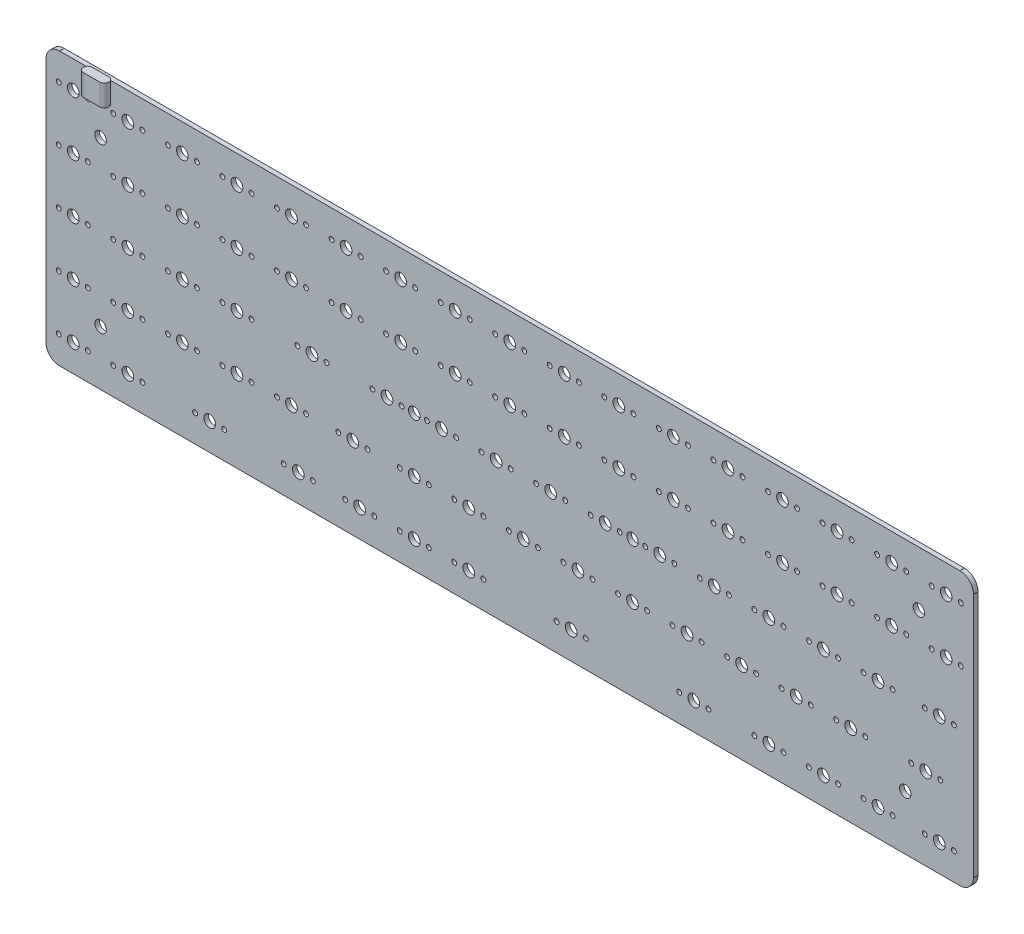
from build123d import *

# Parameters (mm, degrees)
SKETCH2_R                = 0.8534
SKETCH2_R_2              = 2.0447
SKETCH2_R_3              = 2
SKETCH2_R_4              = 0.325
BOSS_EXTRUDE3_DEPTH      = 0.79375
BOSS_EXTRUDE4_DEPTH      = 0.762
BOSS_EXTRUDE4_DEPTH_BACK = 6.731


with BuildPart() as part:
    # Sketch2 → Boss-Extrude3 (new, symmetric)
    with BuildSketch(Plane.XY):
        with BuildLine():
            ThreePointArc((314.2869, -4.7625), (314.298059232, -4.735559232), (314.325, -4.7244))
            Line((314.325, -4.7244), (314.325, 80.9244))
            ThreePointArc((314.325, 80.9244), (314.298059232, 80.935559232), (314.2869, 80.9625))
            ThreePointArc((314.2869, 80.9625), (314.298005094, 80.989386522), (314.324846721, 81.000599692))
            ThreePointArc((314.324846721, 81.000599692), (312.93006375, 84.33006375), (309.600599692, 85.724846721))
            ThreePointArc((309.600599692, 85.724846721), (309.589386522, 85.698005094), (309.5625, 85.6869))
            ThreePointArc((309.5625, 85.6869), (309.535559232, 85.698059232), (309.5244, 85.725))
            Line((309.5244, 85.725), (-4.7244, 85.725))
            ThreePointArc((-4.7244, 85.725), (-4.735559232, 85.698059232), (-4.7625, 85.6869))
            ThreePointArc((-4.7625, 85.6869), (-4.789386522, 85.698005094), (-4.800599692, 85.724846721))
            ThreePointArc((-4.800599692, 85.724846721), (-8.13006375, 84.33006375), (-9.524846721, 81.000599692))
            ThreePointArc((-9.524846721, 81.000599692), (-9.498005094, 80.989386522), (-9.4869, 80.9625))
            ThreePointArc((-9.4869, 80.9625), (-9.498059232, 80.935559232), (-9.525, 80.9244))
            Line((-9.525, 80.9244), (-9.525, -4.7244))
            ThreePointArc((-9.525, -4.7244), (-9.498059232, -4.735559232), (-9.4869, -4.7625))
            ThreePointArc((-9.4869, -4.7625), (-9.498005094, -4.789386522), (-9.524846721, -4.800599692))
            ThreePointArc((-9.524846721, -4.800599692), (-8.13006375, -8.13006375), (-4.800599692, -9.524846721))
            ThreePointArc((-4.800599692, -9.524846721), (-4.789386522, -9.498005094), (-4.7625, -9.4869))
            ThreePointArc((-4.7625, -9.4869), (-4.735559232, -9.498059232), (-4.7244, -9.525))
            Line((-4.7244, -9.525), (309.5244, -9.525))
            ThreePointArc((309.5244, -9.525), (309.535559232, -9.498059232), (309.5625, -9.4869))
            ThreePointArc((309.5625, -9.4869), (309.589386522, -9.498005094), (309.600599692, -9.524846721))
            ThreePointArc((309.600599692, -9.524846721), (312.93006375, -8.13006375), (314.324846721, -4.800599692))
            ThreePointArc((314.324846721, -4.800599692), (314.298005094, -4.789386522), (314.2869, -4.7625))
        make_face()
        with Locations((-5.08, 0)):
            Circle(SKETCH2_R, mode=Mode.SUBTRACT)
        Circle(SKETCH2_R_2, mode=Mode.SUBTRACT)
        with Locations((5.08, 0)):
            Circle(SKETCH2_R, mode=Mode.SUBTRACT)
        with Locations((13.97, 0)):
            Circle(SKETCH2_R, mode=Mode.SUBTRACT)
        with Locations((19.05, 0)):
            Circle(SKETCH2_R_2, mode=Mode.SUBTRACT)
        with Locations((24.13, 0)):
            Circle(SKETCH2_R, mode=Mode.SUBTRACT)
        with Locations((42.545, 0)):
            Circle(SKETCH2_R, mode=Mode.SUBTRACT)
        with Locations((47.625, 0)):
            Circle(SKETCH2_R_2, mode=Mode.SUBTRACT)
        with Locations((52.705, 0)):
            Circle(SKETCH2_R, mode=Mode.SUBTRACT)
        with Locations((9.525, 9.525)):
            Circle(SKETCH2_R_3, mode=Mode.SUBTRACT)
        with Locations((73.5012, 0)):
            Circle(SKETCH2_R, mode=Mode.SUBTRACT)
        with Locations((78.5812, 0)):
            Circle(SKETCH2_R_2, mode=Mode.SUBTRACT)
        with Locations((83.6613, 0)):
            Circle(SKETCH2_R, mode=Mode.SUBTRACT)
        with Locations((94.9325, 0)):
            Circle(SKETCH2_R, mode=Mode.SUBTRACT)
        with Locations((100.0125, 0)):
            Circle(SKETCH2_R_2, mode=Mode.SUBTRACT)
        with Locations((105.0925, 0)):
            Circle(SKETCH2_R, mode=Mode.SUBTRACT)
        with Locations((113.9825, 0)):
            Circle(SKETCH2_R, mode=Mode.SUBTRACT)
        with Locations((119.0625, 0)):
            Circle(SKETCH2_R_2, mode=Mode.SUBTRACT)
        with Locations((124.1425, 0)):
            Circle(SKETCH2_R, mode=Mode.SUBTRACT)
        with Locations((133.0325, 0)):
            Circle(SKETCH2_R, mode=Mode.SUBTRACT)
        with Locations((138.1125, 0)):
            Circle(SKETCH2_R_2, mode=Mode.SUBTRACT)
        with Locations((143.1925, 0)):
            Circle(SKETCH2_R, mode=Mode.SUBTRACT)
        with Locations((-5.08, 19.05)):
            Circle(SKETCH2_R, mode=Mode.SUBTRACT)
        with Locations((0, 19.05)):
            Circle(SKETCH2_R_2, mode=Mode.SUBTRACT)
        with Locations((5.08, 19.05)):
            Circle(SKETCH2_R, mode=Mode.SUBTRACT)
        with Locations((13.97, 19.05)):
            Circle(SKETCH2_R, mode=Mode.SUBTRACT)
        with Locations((19.05, 19.05)):
            Circle(SKETCH2_R_2, mode=Mode.SUBTRACT)
        with Locations((24.13, 19.05)):
            Circle(SKETCH2_R, mode=Mode.SUBTRACT)
        with Locations((33.02, 19.05)):
            Circle(SKETCH2_R, mode=Mode.SUBTRACT)
        with Locations((38.1, 19.05)):
            Circle(SKETCH2_R_2, mode=Mode.SUBTRACT)
        with Locations((43.18, 19.05)):
            Circle(SKETCH2_R, mode=Mode.SUBTRACT)
        with Locations((52.07, 19.05)):
            Circle(SKETCH2_R, mode=Mode.SUBTRACT)
        with Locations((57.15, 19.05)):
            Circle(SKETCH2_R_2, mode=Mode.SUBTRACT)
        with Locations((62.23, 19.05)):
            Circle(SKETCH2_R, mode=Mode.SUBTRACT)
        with Locations((71.12, 19.05)):
            Circle(SKETCH2_R, mode=Mode.SUBTRACT)
        with Locations((76.2, 19.05)):
            Circle(SKETCH2_R_2, mode=Mode.SUBTRACT)
        with Locations((81.28, 19.05)):
            Circle(SKETCH2_R, mode=Mode.SUBTRACT)
        with Locations((92.5513, 19.05)):
            Circle(SKETCH2_R, mode=Mode.SUBTRACT)
        with Locations((97.6313, 19.05)):
            Circle(SKETCH2_R_2, mode=Mode.SUBTRACT)
        with Locations((102.7113, 19.05)):
            Circle(SKETCH2_R, mode=Mode.SUBTRACT)
        with Locations((113.9825, 19.05)):
            Circle(SKETCH2_R, mode=Mode.SUBTRACT)
        with Locations((119.0625, 19.05)):
            Circle(SKETCH2_R_2, mode=Mode.SUBTRACT)
        with Locations((124.1425, 19.05)):
            Circle(SKETCH2_R, mode=Mode.SUBTRACT)
        with Locations((133.0325, 19.05)):
            Circle(SKETCH2_R, mode=Mode.SUBTRACT)
        with Locations((138.1125, 19.05)):
            Circle(SKETCH2_R_2, mode=Mode.SUBTRACT)
        with Locations((143.1925, 19.05)):
            Circle(SKETCH2_R, mode=Mode.SUBTRACT)
        with Locations((152.0825, 19.05)):
            Circle(SKETCH2_R, mode=Mode.SUBTRACT)
        with Locations((168.7512, 0)):
            Circle(SKETCH2_R, mode=Mode.SUBTRACT)
        with Locations((173.8313, 0)):
            Circle(SKETCH2_R_2, mode=Mode.SUBTRACT)
        with Locations((178.9112, 0)):
            Circle(SKETCH2_R, mode=Mode.SUBTRACT)
        with Locations((211.6138, 0)):
            Circle(SKETCH2_R, mode=Mode.SUBTRACT)
        with Locations((216.6938, 0)):
            Circle(SKETCH2_R_2, mode=Mode.SUBTRACT)
        with Locations((221.7738, 0)):
            Circle(SKETCH2_R, mode=Mode.SUBTRACT)
        with Locations((237.8075, 0)):
            Circle(SKETCH2_R, mode=Mode.SUBTRACT)
        with Locations((242.8875, 0)):
            Circle(SKETCH2_R_2, mode=Mode.SUBTRACT)
        with Locations((247.9675, 0)):
            Circle(SKETCH2_R, mode=Mode.SUBTRACT)
        with Locations((256.8575, 0)):
            Circle(SKETCH2_R, mode=Mode.SUBTRACT)
        with Locations((261.9375, 0)):
            Circle(SKETCH2_R_2, mode=Mode.SUBTRACT)
        with Locations((267.0175, 0)):
            Circle(SKETCH2_R, mode=Mode.SUBTRACT)
        with Locations((275.9075, 0)):
            Circle(SKETCH2_R, mode=Mode.SUBTRACT)
        with Locations((280.9875, 0)):
            Circle(SKETCH2_R_2, mode=Mode.SUBTRACT)
        with Locations((286.0675, 0)):
            Circle(SKETCH2_R, mode=Mode.SUBTRACT)
        with Locations((297.3388, 0)):
            Circle(SKETCH2_R, mode=Mode.SUBTRACT)
        with Locations((302.4187, 0)):
            Circle(SKETCH2_R_2, mode=Mode.SUBTRACT)
        with Locations((307.4988, 0)):
            Circle(SKETCH2_R, mode=Mode.SUBTRACT)
        with Locations((290.5125, 9.525)):
            Circle(SKETCH2_R_3, mode=Mode.SUBTRACT)
        with Locations((157.1625, 19.05)):
            Circle(SKETCH2_R_2, mode=Mode.SUBTRACT)
        with Locations((162.2425, 19.05)):
            Circle(SKETCH2_R, mode=Mode.SUBTRACT)
        with Locations((171.1325, 19.05)):
            Circle(SKETCH2_R, mode=Mode.SUBTRACT)
        with Locations((176.2125, 19.05)):
            Circle(SKETCH2_R_2, mode=Mode.SUBTRACT)
        with Locations((181.2925, 19.05)):
            Circle(SKETCH2_R, mode=Mode.SUBTRACT)
        with Locations((190.1825, 19.05)):
            Circle(SKETCH2_R, mode=Mode.SUBTRACT)
        with Locations((195.2625, 19.05)):
            Circle(SKETCH2_R_2, mode=Mode.SUBTRACT)
        with Locations((200.3425, 19.05)):
            Circle(SKETCH2_R, mode=Mode.SUBTRACT)
        with Locations((209.2325, 19.05)):
            Circle(SKETCH2_R, mode=Mode.SUBTRACT)
        with Locations((214.3125, 19.05)):
            Circle(SKETCH2_R_2, mode=Mode.SUBTRACT)
        with Locations((219.3925, 19.05)):
            Circle(SKETCH2_R, mode=Mode.SUBTRACT)
        with Locations((228.2825, 19.05)):
            Circle(SKETCH2_R, mode=Mode.SUBTRACT)
        with Locations((233.3625, 19.05)):
            Circle(SKETCH2_R_2, mode=Mode.SUBTRACT)
        with Locations((238.4425, 19.05)):
            Circle(SKETCH2_R, mode=Mode.SUBTRACT)
        with Locations((247.3325, 19.05)):
            Circle(SKETCH2_R, mode=Mode.SUBTRACT)
        with Locations((252.4125, 19.05)):
            Circle(SKETCH2_R_2, mode=Mode.SUBTRACT)
        with Locations((257.4925, 19.05)):
            Circle(SKETCH2_R, mode=Mode.SUBTRACT)
        with Locations((266.3825, 19.05)):
            Circle(SKETCH2_R, mode=Mode.SUBTRACT)
        with Locations((271.4625, 19.05)):
            Circle(SKETCH2_R_2, mode=Mode.SUBTRACT)
        with Locations((276.5425, 19.05)):
            Circle(SKETCH2_R, mode=Mode.SUBTRACT)
        with Locations((292.5763, 19.05)):
            Circle(SKETCH2_R, mode=Mode.SUBTRACT)
        with Locations((297.6563, 19.05)):
            Circle(SKETCH2_R_2, mode=Mode.SUBTRACT)
        with Locations((302.7363, 19.05)):
            Circle(SKETCH2_R, mode=Mode.SUBTRACT)
        with Locations((-5.08, 38.1)):
            Circle(SKETCH2_R, mode=Mode.SUBTRACT)
        with Locations((0, 38.1)):
            Circle(SKETCH2_R_2, mode=Mode.SUBTRACT)
        with Locations((5.08, 38.1)):
            Circle(SKETCH2_R, mode=Mode.SUBTRACT)
        with Locations((13.97, 38.1)):
            Circle(SKETCH2_R, mode=Mode.SUBTRACT)
        with Locations((19.05, 38.1)):
            Circle(SKETCH2_R_2, mode=Mode.SUBTRACT)
        with Locations((24.13, 38.1)):
            Circle(SKETCH2_R, mode=Mode.SUBTRACT)
        with Locations((33.02, 38.1)):
            Circle(SKETCH2_R, mode=Mode.SUBTRACT)
        with Locations((38.1, 38.1)):
            Circle(SKETCH2_R_2, mode=Mode.SUBTRACT)
        with Locations((43.18, 38.1)):
            Circle(SKETCH2_R, mode=Mode.SUBTRACT)
        with Locations((52.07, 38.1)):
            Circle(SKETCH2_R, mode=Mode.SUBTRACT)
        with Locations((57.15, 38.1)):
            Circle(SKETCH2_R_2, mode=Mode.SUBTRACT)
        with Locations((62.23, 38.1)):
            Circle(SKETCH2_R, mode=Mode.SUBTRACT)
        with Locations((-5.08, 57.15)):
            Circle(SKETCH2_R, mode=Mode.SUBTRACT)
        with Locations((0, 57.15)):
            Circle(SKETCH2_R_2, mode=Mode.SUBTRACT)
        with Locations((5.08, 57.15)):
            Circle(SKETCH2_R, mode=Mode.SUBTRACT)
        with Locations((13.97, 57.15)):
            Circle(SKETCH2_R, mode=Mode.SUBTRACT)
        with Locations((19.05, 57.15)):
            Circle(SKETCH2_R_2, mode=Mode.SUBTRACT)
        with Locations((24.13, 57.15)):
            Circle(SKETCH2_R, mode=Mode.SUBTRACT)
        with Locations((33.02, 57.15)):
            Circle(SKETCH2_R, mode=Mode.SUBTRACT)
        with Locations((38.1, 57.15)):
            Circle(SKETCH2_R_2, mode=Mode.SUBTRACT)
        with Locations((43.18, 57.15)):
            Circle(SKETCH2_R, mode=Mode.SUBTRACT)
        with Locations((52.07, 57.15)):
            Circle(SKETCH2_R, mode=Mode.SUBTRACT)
        with Locations((57.15, 57.15)):
            Circle(SKETCH2_R_2, mode=Mode.SUBTRACT)
        with Locations((62.23, 57.15)):
            Circle(SKETCH2_R, mode=Mode.SUBTRACT)
        with Locations((71.12, 57.15)):
            Circle(SKETCH2_R, mode=Mode.SUBTRACT)
        with Locations((78.2638, 38.1)):
            Circle(SKETCH2_R, mode=Mode.SUBTRACT)
        with Locations((83.3438, 38.1)):
            Circle(SKETCH2_R_2, mode=Mode.SUBTRACT)
        with Locations((88.4237, 38.1)):
            Circle(SKETCH2_R, mode=Mode.SUBTRACT)
        with Locations((104.4575, 38.1)):
            Circle(SKETCH2_R, mode=Mode.SUBTRACT)
        with Locations((109.5375, 38.1)):
            Circle(SKETCH2_R_2, mode=Mode.SUBTRACT)
        with Locations((114.6175, 38.1)):
            Circle(SKETCH2_R, mode=Mode.SUBTRACT)
        with Locations((119.0625, 38.1)):
            Circle(SKETCH2_R_3, mode=Mode.SUBTRACT)
        with Locations((123.5075, 38.1)):
            Circle(SKETCH2_R, mode=Mode.SUBTRACT)
        with Locations((128.5875, 38.1)):
            Circle(SKETCH2_R_2, mode=Mode.SUBTRACT)
        with Locations((133.6675, 38.1)):
            Circle(SKETCH2_R, mode=Mode.SUBTRACT)
        with Locations((142.5575, 38.1)):
            Circle(SKETCH2_R, mode=Mode.SUBTRACT)
        with Locations((147.6375, 38.1)):
            Circle(SKETCH2_R_2, mode=Mode.SUBTRACT)
        with Locations((76.2, 57.15)):
            Circle(SKETCH2_R_2, mode=Mode.SUBTRACT)
        with Locations((81.28, 57.15)):
            Circle(SKETCH2_R, mode=Mode.SUBTRACT)
        with Locations((90.17, 57.15)):
            Circle(SKETCH2_R, mode=Mode.SUBTRACT)
        with Locations((95.25, 57.15)):
            Circle(SKETCH2_R_2, mode=Mode.SUBTRACT)
        with Locations((100.33, 57.15)):
            Circle(SKETCH2_R, mode=Mode.SUBTRACT)
        with Locations((109.22, 57.15)):
            Circle(SKETCH2_R, mode=Mode.SUBTRACT)
        with Locations((114.3, 57.15)):
            Circle(SKETCH2_R_2, mode=Mode.SUBTRACT)
        with Locations((119.38, 57.15)):
            Circle(SKETCH2_R, mode=Mode.SUBTRACT)
        with Locations((128.27, 57.15)):
            Circle(SKETCH2_R, mode=Mode.SUBTRACT)
        with Locations((133.35, 57.15)):
            Circle(SKETCH2_R_2, mode=Mode.SUBTRACT)
        with Locations((138.43, 57.15)):
            Circle(SKETCH2_R, mode=Mode.SUBTRACT)
        with Locations((147.32, 57.15)):
            Circle(SKETCH2_R, mode=Mode.SUBTRACT)
        with Locations((9.525, 66.675)):
            Circle(SKETCH2_R_3, mode=Mode.SUBTRACT)
        with Locations((-5.08, 76.2)):
            Circle(SKETCH2_R, mode=Mode.SUBTRACT)
        with Locations((0, 76.2)):
            Circle(SKETCH2_R_2, mode=Mode.SUBTRACT)
        with Locations((5.08, 76.2)):
            Circle(SKETCH2_R, mode=Mode.SUBTRACT)
        with Locations((13.97, 76.2)):
            Circle(SKETCH2_R, mode=Mode.SUBTRACT)
        with Locations((19.05, 76.2)):
            Circle(SKETCH2_R_2, mode=Mode.SUBTRACT)
        with Locations((24.13, 76.2)):
            Circle(SKETCH2_R, mode=Mode.SUBTRACT)
        with Locations((6.635, 80.6463)):
            Circle(SKETCH2_R_4, mode=Mode.SUBTRACT)
        with Locations((12.415, 80.6463)):
            Circle(SKETCH2_R_4, mode=Mode.SUBTRACT)
        with Locations((33.02, 76.2)):
            Circle(SKETCH2_R, mode=Mode.SUBTRACT)
        with Locations((38.1, 76.2)):
            Circle(SKETCH2_R_2, mode=Mode.SUBTRACT)
        with Locations((43.18, 76.2)):
            Circle(SKETCH2_R, mode=Mode.SUBTRACT)
        with Locations((52.07, 76.2)):
            Circle(SKETCH2_R, mode=Mode.SUBTRACT)
        with Locations((57.15, 76.2)):
            Circle(SKETCH2_R_2, mode=Mode.SUBTRACT)
        with Locations((62.23, 76.2)):
            Circle(SKETCH2_R, mode=Mode.SUBTRACT)
        with Locations((71.12, 76.2)):
            Circle(SKETCH2_R, mode=Mode.SUBTRACT)
        with Locations((76.2, 76.2)):
            Circle(SKETCH2_R_2, mode=Mode.SUBTRACT)
        with Locations((81.28, 76.2)):
            Circle(SKETCH2_R, mode=Mode.SUBTRACT)
        with Locations((90.17, 76.2)):
            Circle(SKETCH2_R, mode=Mode.SUBTRACT)
        with Locations((95.25, 76.2)):
            Circle(SKETCH2_R_2, mode=Mode.SUBTRACT)
        with Locations((100.33, 76.2)):
            Circle(SKETCH2_R, mode=Mode.SUBTRACT)
        with Locations((109.22, 76.2)):
            Circle(SKETCH2_R, mode=Mode.SUBTRACT)
        with Locations((114.3, 76.2)):
            Circle(SKETCH2_R_2, mode=Mode.SUBTRACT)
        with Locations((119.38, 76.2)):
            Circle(SKETCH2_R, mode=Mode.SUBTRACT)
        with Locations((128.27, 76.2)):
            Circle(SKETCH2_R, mode=Mode.SUBTRACT)
        with Locations((133.35, 76.2)):
            Circle(SKETCH2_R_2, mode=Mode.SUBTRACT)
        with Locations((138.43, 76.2)):
            Circle(SKETCH2_R, mode=Mode.SUBTRACT)
        with Locations((147.32, 76.2)):
            Circle(SKETCH2_R, mode=Mode.SUBTRACT)
        with Locations((152.7175, 38.1)):
            Circle(SKETCH2_R, mode=Mode.SUBTRACT)
        with Locations((161.6075, 38.1)):
            Circle(SKETCH2_R, mode=Mode.SUBTRACT)
        with Locations((166.6875, 38.1)):
            Circle(SKETCH2_R_2, mode=Mode.SUBTRACT)
        with Locations((171.7675, 38.1)):
            Circle(SKETCH2_R, mode=Mode.SUBTRACT)
        with Locations((180.6575, 38.1)):
            Circle(SKETCH2_R, mode=Mode.SUBTRACT)
        with Locations((185.7375, 38.1)):
            Circle(SKETCH2_R_2, mode=Mode.SUBTRACT)
        with Locations((190.8175, 38.1)):
            Circle(SKETCH2_R, mode=Mode.SUBTRACT)
        with Locations((195.2625, 38.1)):
            Circle(SKETCH2_R_3, mode=Mode.SUBTRACT)
        with Locations((199.7075, 38.1)):
            Circle(SKETCH2_R, mode=Mode.SUBTRACT)
        with Locations((204.7875, 38.1)):
            Circle(SKETCH2_R_2, mode=Mode.SUBTRACT)
        with Locations((209.8675, 38.1)):
            Circle(SKETCH2_R, mode=Mode.SUBTRACT)
        with Locations((218.7575, 38.1)):
            Circle(SKETCH2_R, mode=Mode.SUBTRACT)
        with Locations((223.8375, 38.1)):
            Circle(SKETCH2_R_2, mode=Mode.SUBTRACT)
        with Locations((228.9175, 38.1)):
            Circle(SKETCH2_R, mode=Mode.SUBTRACT)
        with Locations((152.4, 57.15)):
            Circle(SKETCH2_R_2, mode=Mode.SUBTRACT)
        with Locations((157.48, 57.15)):
            Circle(SKETCH2_R, mode=Mode.SUBTRACT)
        with Locations((166.37, 57.15)):
            Circle(SKETCH2_R, mode=Mode.SUBTRACT)
        with Locations((171.45, 57.15)):
            Circle(SKETCH2_R_2, mode=Mode.SUBTRACT)
        with Locations((176.53, 57.15)):
            Circle(SKETCH2_R, mode=Mode.SUBTRACT)
        with Locations((185.42, 57.15)):
            Circle(SKETCH2_R, mode=Mode.SUBTRACT)
        with Locations((190.5, 57.15)):
            Circle(SKETCH2_R_2, mode=Mode.SUBTRACT)
        with Locations((195.58, 57.15)):
            Circle(SKETCH2_R, mode=Mode.SUBTRACT)
        with Locations((204.47, 57.15)):
            Circle(SKETCH2_R, mode=Mode.SUBTRACT)
        with Locations((209.55, 57.15)):
            Circle(SKETCH2_R_2, mode=Mode.SUBTRACT)
        with Locations((214.63, 57.15)):
            Circle(SKETCH2_R, mode=Mode.SUBTRACT)
        with Locations((223.52, 57.15)):
            Circle(SKETCH2_R, mode=Mode.SUBTRACT)
        with Locations((228.6, 57.15)):
            Circle(SKETCH2_R_2, mode=Mode.SUBTRACT)
        with Locations((237.8075, 38.1)):
            Circle(SKETCH2_R, mode=Mode.SUBTRACT)
        with Locations((242.8875, 38.1)):
            Circle(SKETCH2_R_2, mode=Mode.SUBTRACT)
        with Locations((247.9675, 38.1)):
            Circle(SKETCH2_R, mode=Mode.SUBTRACT)
        with Locations((256.8575, 38.1)):
            Circle(SKETCH2_R, mode=Mode.SUBTRACT)
        with Locations((261.9375, 38.1)):
            Circle(SKETCH2_R_2, mode=Mode.SUBTRACT)
        with Locations((267.0175, 38.1)):
            Circle(SKETCH2_R, mode=Mode.SUBTRACT)
        with Locations((275.9075, 38.1)):
            Circle(SKETCH2_R, mode=Mode.SUBTRACT)
        with Locations((280.9875, 38.1)):
            Circle(SKETCH2_R_2, mode=Mode.SUBTRACT)
        with Locations((286.0675, 38.1)):
            Circle(SKETCH2_R, mode=Mode.SUBTRACT)
        with Locations((297.3388, 38.1)):
            Circle(SKETCH2_R, mode=Mode.SUBTRACT)
        with Locations((302.4187, 38.1)):
            Circle(SKETCH2_R_2, mode=Mode.SUBTRACT)
        with Locations((307.4988, 38.1)):
            Circle(SKETCH2_R, mode=Mode.SUBTRACT)
        with Locations((233.68, 57.15)):
            Circle(SKETCH2_R, mode=Mode.SUBTRACT)
        with Locations((242.57, 57.15)):
            Circle(SKETCH2_R, mode=Mode.SUBTRACT)
        with Locations((247.65, 57.15)):
            Circle(SKETCH2_R_2, mode=Mode.SUBTRACT)
        with Locations((252.73, 57.15)):
            Circle(SKETCH2_R, mode=Mode.SUBTRACT)
        with Locations((261.62, 57.15)):
            Circle(SKETCH2_R, mode=Mode.SUBTRACT)
        with Locations((266.7, 57.15)):
            Circle(SKETCH2_R_2, mode=Mode.SUBTRACT)
        with Locations((271.78, 57.15)):
            Circle(SKETCH2_R, mode=Mode.SUBTRACT)
        with Locations((280.67, 57.15)):
            Circle(SKETCH2_R, mode=Mode.SUBTRACT)
        with Locations((285.75, 57.15)):
            Circle(SKETCH2_R_2, mode=Mode.SUBTRACT)
        with Locations((290.83, 57.15)):
            Circle(SKETCH2_R, mode=Mode.SUBTRACT)
        with Locations((299.72, 57.15)):
            Circle(SKETCH2_R, mode=Mode.SUBTRACT)
        with Locations((304.8, 57.15)):
            Circle(SKETCH2_R_2, mode=Mode.SUBTRACT)
        with Locations((309.88, 57.15)):
            Circle(SKETCH2_R, mode=Mode.SUBTRACT)
        with Locations((152.4, 76.2)):
            Circle(SKETCH2_R_2, mode=Mode.SUBTRACT)
        with Locations((157.48, 76.2)):
            Circle(SKETCH2_R, mode=Mode.SUBTRACT)
        with Locations((166.37, 76.2)):
            Circle(SKETCH2_R, mode=Mode.SUBTRACT)
        with Locations((171.45, 76.2)):
            Circle(SKETCH2_R_2, mode=Mode.SUBTRACT)
        with Locations((176.53, 76.2)):
            Circle(SKETCH2_R, mode=Mode.SUBTRACT)
        with Locations((185.42, 76.2)):
            Circle(SKETCH2_R, mode=Mode.SUBTRACT)
        with Locations((190.5, 76.2)):
            Circle(SKETCH2_R_2, mode=Mode.SUBTRACT)
        with Locations((195.58, 76.2)):
            Circle(SKETCH2_R, mode=Mode.SUBTRACT)
        with Locations((204.47, 76.2)):
            Circle(SKETCH2_R, mode=Mode.SUBTRACT)
        with Locations((209.55, 76.2)):
            Circle(SKETCH2_R_2, mode=Mode.SUBTRACT)
        with Locations((214.63, 76.2)):
            Circle(SKETCH2_R, mode=Mode.SUBTRACT)
        with Locations((223.52, 76.2)):
            Circle(SKETCH2_R, mode=Mode.SUBTRACT)
        with Locations((228.6, 76.2)):
            Circle(SKETCH2_R_2, mode=Mode.SUBTRACT)
        with Locations((295.275, 66.675)):
            Circle(SKETCH2_R_3, mode=Mode.SUBTRACT)
        with Locations((233.68, 76.2)):
            Circle(SKETCH2_R, mode=Mode.SUBTRACT)
        with Locations((242.57, 76.2)):
            Circle(SKETCH2_R, mode=Mode.SUBTRACT)
        with Locations((247.65, 76.2)):
            Circle(SKETCH2_R_2, mode=Mode.SUBTRACT)
        with Locations((252.73, 76.2)):
            Circle(SKETCH2_R, mode=Mode.SUBTRACT)
        with Locations((261.62, 76.2)):
            Circle(SKETCH2_R, mode=Mode.SUBTRACT)
        with Locations((266.7, 76.2)):
            Circle(SKETCH2_R_2, mode=Mode.SUBTRACT)
        with Locations((271.78, 76.2)):
            Circle(SKETCH2_R, mode=Mode.SUBTRACT)
        with Locations((280.67, 76.2)):
            Circle(SKETCH2_R, mode=Mode.SUBTRACT)
        with Locations((285.75, 76.2)):
            Circle(SKETCH2_R_2, mode=Mode.SUBTRACT)
        with Locations((290.83, 76.2)):
            Circle(SKETCH2_R, mode=Mode.SUBTRACT)
        with Locations((299.72, 76.2)):
            Circle(SKETCH2_R, mode=Mode.SUBTRACT)
        with Locations((304.8, 76.2)):
            Circle(SKETCH2_R_2, mode=Mode.SUBTRACT)
        with Locations((309.88, 76.2)):
            Circle(SKETCH2_R, mode=Mode.SUBTRACT)
    extrude(amount=BOSS_EXTRUDE3_DEPTH, both=True)

    # Sketch3 → Boss-Extrude4 (add, two sides: drawn at the far end of the back side and taken through both)
    with BuildSketch(Plane(origin=(0, 85.725, 0), x_dir=(1, 0, 0), z_dir=(0, 1, 0)).offset(-BOSS_EXTRUDE4_DEPTH_BACK)):
        with BuildLine():
            Line((12.415, -3.95375), (6.635, -3.95375))
            ThreePointArc((6.635, -3.95375), (5.055, -2.37375), (6.635, -0.79375))
            Line((6.635, -0.79375), (12.415, -0.79375))
            ThreePointArc((12.415, -0.79375), (13.995, -2.37375), (12.415, -3.95375))
        make_face()
    extrude(amount=BOSS_EXTRUDE4_DEPTH + BOSS_EXTRUDE4_DEPTH_BACK)


solid = part.part
